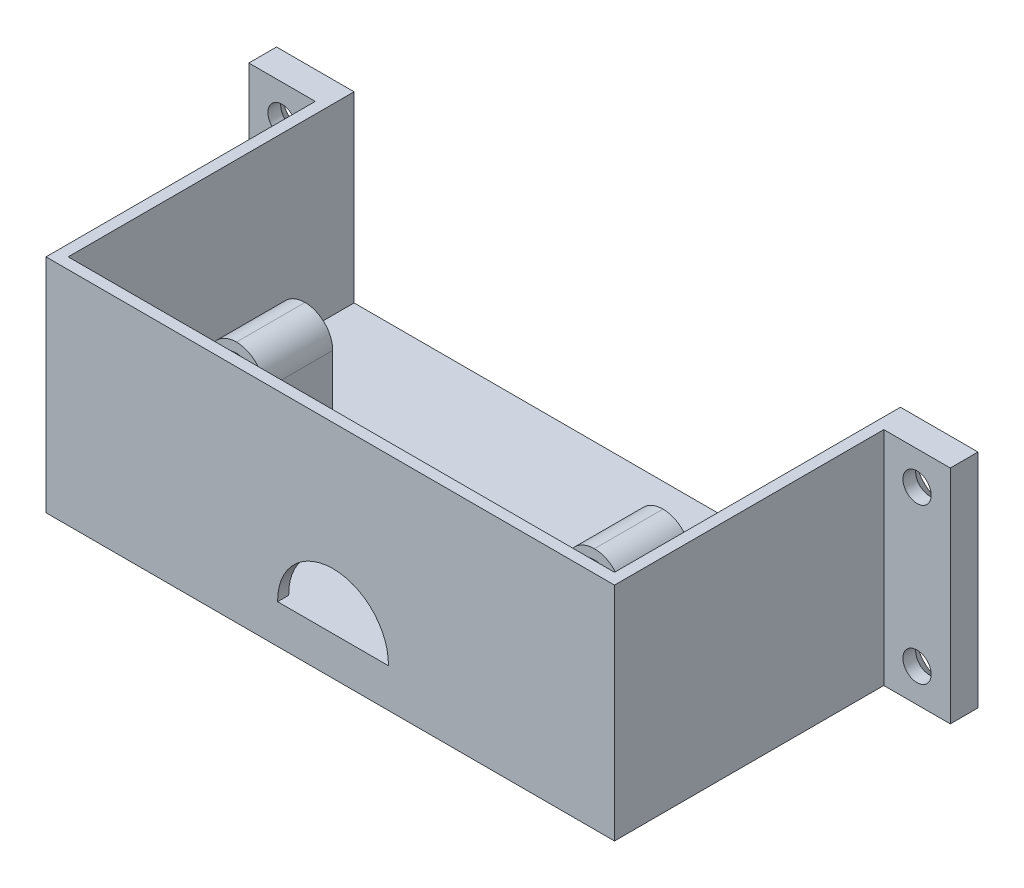
from build123d import *

# Parameters (mm, degrees)
BOSS_EXTRU_1_DEPTH                                = 53.6
BOSS_EXTRU_1_DEPTH_BACK                           = 0.0001
ESQUISSE1_W                                       = 102.6
ESQUISSE1_H                                       = 35
ESQUISSE4_W                                       = 98.6
ESQUISSE4_H                                       = 51.6
ENL_V_MAT_EXTRU_2_DEPTH                           = 33
ESQUISSE9_W                                       = 10
ESQUISSE9_H                                       = 12.38
BOSS_EXTRU_3_DEPTH                                = 21.5
CONG_1_R                                          = 5
ESQUISSE10_R                                      = 3.75
ENL_V_MAT_EXTRU_4_DEPTH                           = 15
ENL_V_MAT_EXTRU_5_DEPTH                           = 2.1
ESQUISSE19_W                                      = 102.6
ESQUISSE19_H                                      = 53.6001
BOSS_EXTRU_4_DEPTH                                = 5
ESQUISSE21_W                                      = 5
ESQUISSE21_H                                      = 40
BOSS_EXTRU_5_DEPTH                                = 12
ESQUISSE22_W                                      = 5
ESQUISSE22_H                                      = 40
BOSS_EXTRU_6_DEPTH                                = 12
FRAISAGE_POUR_VIS_T_TE_FRAIS_E_BOMB_E_D           = 5.09999996
FRAISAGE_POUR_VIS_T_TE_FRAIS_E_BOMB_E_CSINK_D     = 10.500000082
FRAISAGE_POUR_VIS_T_TE_FRAIS_E_BOMB_E_CSINK_ANGLE = 90


with BuildPart() as part:
    # Esquisse1 → Boss.-Extru.1 (new, two sides: drawn at the far end of the back side and taken through both)
    with BuildSketch(Plane.XY.offset(-BOSS_EXTRU_1_DEPTH_BACK)):
        with Locations((33.832170394, 1.686746988)):
            Rectangle(ESQUISSE1_W, ESQUISSE1_H)
    extrude(amount=BOSS_EXTRU_1_DEPTH + BOSS_EXTRU_1_DEPTH_BACK)

    # Esquisse4 → Enlèv. mat.-Extru.2 (cut)
    with BuildSketch(Plane(origin=(0, 19.186746988, 0), x_dir=(1, 0, 0), z_dir=(0, 1, 0))):
        with Locations((33.832170394, -25.7999)):
            Rectangle(ESQUISSE4_W, ESQUISSE4_H)
    extrude(amount=-ENL_V_MAT_EXTRU_2_DEPTH, mode=Mode.SUBTRACT)

    # Esquisse9 → Boss.-Extru.3 (add)
    with BuildSketch(Plane(origin=(0, -13.813253012, 0), x_dir=(1, 0, 0), z_dir=(0, 1, 0))):
        with Locations((1.532170394, -32.0399)):
            Rectangle(ESQUISSE9_W, ESQUISSE9_H)
        with Locations((66.132170394, -32.0399)):
            Rectangle(ESQUISSE9_W, ESQUISSE9_H)
    extrude(amount=BOSS_EXTRU_3_DEPTH)

    # Congé1
    cong_1_edges = [part.edges().sort_by_distance(p)[0] for p in [
        (-3.467829606, 7.686746988, 32.0399),
        (6.532170394, 7.686746988, 32.0399),
        (71.132170394, 7.686746988, 32.0399),
        (61.132170394, 7.686746988, 32.0399),
    ]]
    fillet(cong_1_edges, radius=CONG_1_R - 0.0001)  # a hair under: the kernel refuses the full size

    # Esquisse10 → Enlèv. mat.-Extru.4 (cut)
    with BuildSketch(Plane(origin=(0, 0, 25.8499), x_dir=(-1, 0, 0), z_dir=(0, 0, -1))):
        with Locations((-66.132170394, 2.186746988)):
            Circle(ESQUISSE10_R)
        with Locations((-1.532170394, 2.186746988)):
            Circle(ESQUISSE10_R)
    extrude(amount=-ENL_V_MAT_EXTRU_4_DEPTH, mode=Mode.SUBTRACT)

    # Esquisse18 → Enlèv. mat.-Extru.5 (cut)
    with BuildSketch(Plane.XY.offset(53.6)):
        with BuildLine():
            Line((24.333519225, -13.813253012), (44.330821563, -13.813253012))
            ThreePointArc((44.330821563, -13.813253012), (34.332170394, -3.643205178), (24.333519225, -13.813253012))
        make_face()
    extrude(amount=-ENL_V_MAT_EXTRU_5_DEPTH, mode=Mode.SUBTRACT)

    # Esquisse19 → Boss.-Extru.4 (add)
    with BuildSketch(Plane.XZ.offset(15.813253012)):
        with Locations((33.832170394, 26.79995)):
            Rectangle(ESQUISSE19_W, ESQUISSE19_H)
    extrude(amount=BOSS_EXTRU_4_DEPTH)

    # Esquisse21 → Boss.-Extru.5 (add)
    with BuildSketch(Plane.ZY.offset(17.467829606)):
        with Locations((2.4999, -0.813253012)):
            Rectangle(ESQUISSE21_W, ESQUISSE21_H)
    extrude(amount=BOSS_EXTRU_5_DEPTH)

    # Esquisse22 → Boss.-Extru.6 (add)
    with BuildSketch(Plane(origin=(85.132170394, 0, 0), x_dir=(0, 0, -1), z_dir=(1, 0, 0))):
        with Locations((-2.4999, -0.813253012)):
            Rectangle(ESQUISSE22_W, ESQUISSE22_H)
    extrude(amount=BOSS_EXTRU_6_DEPTH)

    # Fraisage pour vis à tête fraisée bombée #51 (through all)
    with Locations(Plane(origin=(91.132170394, 13.186746988, -0.0001), x_dir=(-1, 0, 0), z_dir=(0, 0, -1))):
        with Locations((0, 0), (0, -28), (114.6, 0), (114.6, -28)):
            CounterSinkHole(FRAISAGE_POUR_VIS_T_TE_FRAIS_E_BOMB_E_D / 2, FRAISAGE_POUR_VIS_T_TE_FRAIS_E_BOMB_E_CSINK_D / 2, counter_sink_angle=FRAISAGE_POUR_VIS_T_TE_FRAIS_E_BOMB_E_CSINK_ANGLE)


solid = part.part
